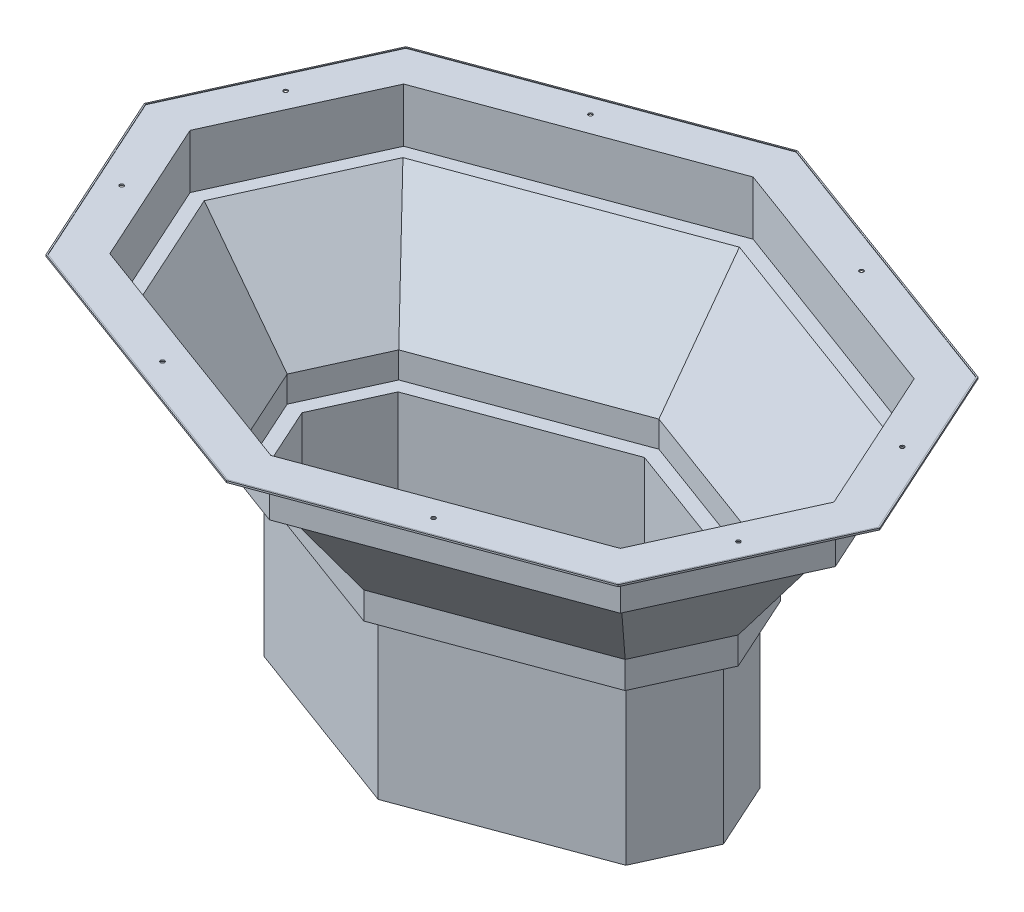
from build123d import *

# Parameters (mm, degrees)
BOSS_EXTRUDE1_DEPTH = 101.6
BOSS_EXTRUDE2_DEPTH = 50.8
BOSS_EXTRUDE3_DEPTH = 3.175
BOSS_EXTRUDE4_DEPTH = 304.8
SHELL2_T            = -2.38125
CUT_EXTRUDE1_REACH  = 1102.395
SKETCH8_R           = 3.81


with BuildPart() as part:
    # Sketch1 → Boss-Extrude1 (new body)
    with BuildSketch(Plane(origin=(0, 0, 0), x_dir=(1, 0, 0), z_dir=(0, 1, 0))):
        Polygon((-609.6, 0), (-483.050585246, 278.889385424), (0, 457.2), (483.050585246, 278.889385424), (609.6, 0), (483.050585246, -278.889385424), (0, -457.2), (-483.050585246, -278.889385424), align=None)
    extrude(amount=-BOSS_EXTRUDE1_DEPTH)

    # Sketch3 → Loft1 section 0
    with BuildSketch(Plane.XZ.offset(101.6)):
        with BuildLine():
            Line((-464.303577892, -258.734292578), (0, -430.124740809))
            Line((0, -430.124740809), (464.303577892, -258.734292578))
            Line((464.303577892, -258.734292578), (581.707376723, 0))
            Line((581.707376723, 0), (464.303577892, 258.734292578))
            Line((464.303577892, 258.734292578), (0, 430.124740809))
            Line((0, 430.124740809), (-464.303577892, 258.734292578))
            Line((-464.303577892, 258.734292578), (-581.707376723, 0))
            Line((-581.707376723, 0), (-464.303577892, -258.734292578))
        make_face()
    # Sketch2 → Loft1 section 1
    with BuildSketch(Plane(origin=(0, -304.8, 0), x_dir=(-1, 0, 0), z_dir=(0, -1, 0))):
        with BuildLine():
            Line((0, 279.492456), (-360.005239282, 146.602118161))
            Line((-360.005239282, 146.602118161), (-426.527714588, 0))
            Line((-426.527714588, 0), (-360.005239282, -146.602118161))
            Line((-360.005239282, -146.602118161), (0, -279.492456))
            Line((0, -279.492456), (360.005239282, -146.602118161))
            Line((360.005239282, -146.602118161), (426.527714588, 0))
            Line((426.527714588, 0), (360.005239282, 146.602118161))
            Line((360.005239282, 146.602118161), (0, 279.492456))
        make_face()
    loft()

    # Sketch4 → Boss-Extrude2 (add)
    with BuildSketch(Plane.XZ.offset(304.8)):
        Polygon((0, -279.492456), (360.005239282, -146.602118161), (426.527714588, 0), (360.005239282, 146.602118161), (0, 279.492456), (-360.005239282, 146.602118161), (-426.527714588, 0), (-360.005239282, -146.602118161), align=None)
    extrude(amount=BOSS_EXTRUDE2_DEPTH)

    # Sketch5 → Boss-Extrude3 (add)
    with BuildSketch(Plane(origin=(0, 0, 0), x_dir=(1, 0, 0), z_dir=(0, 1, 0))):
        Polygon((0, 538.425777574), (-539.291607309, 339.354663964), (-693.277869831, 0), (-539.291607309, -339.354663964), (0, -538.425777574), (539.291607309, -339.354663964), (693.277869831, 0), (539.291607309, 339.354663964), align=None)
    extrude(amount=BOSS_EXTRUDE3_DEPTH)

    # Sketch6 → Boss-Extrude4 (add)
    with BuildSketch(Plane.XZ.offset(355.6)):
        Polygon((0, 252.417196809), (-341.258231928, 126.447025314), (-398.635091311, 0), (-341.258231928, -126.447025314), (0, -252.417196809), (341.258231928, -126.447025314), (398.635091311, 0), (341.258231928, 126.447025314), align=None)
    extrude(amount=BOSS_EXTRUDE4_DEPTH)

    # Shell2
    shell2_openings = [part.faces().sort_by_distance(p)[0] for p in [
        (0, 3.175, 0),
    ]]
    offset(amount=SHELL2_T, openings=shell2_openings, kind=Kind.INTERSECTION)

    # Sketch8 → Cut-Extrude1 (cut, up to next)
    with BuildSketch(Plane(origin=(0, 3.175, 0), x_dir=(1, 0, 0), z_dir=(0, 1, 0)), mode=Mode.PRIVATE) as cut_extrude1_sk1:
        with Locations((-255.585548139, 403.467456741)):
            Circle(SKETCH8_R)
    cut_extrude1_tool1 = extrude(cut_extrude1_sk1.sketch, amount=-CUT_EXTRUDE1_REACH, mode=Mode.PRIVATE) & part.part
    # Sketch8 → Cut-Extrude1 (cut, up to next)
    with BuildSketch(Plane(origin=(0, 3.175, 0), x_dir=(1, 0, 0), z_dir=(0, 1, 0)), mode=Mode.PRIVATE) as cut_extrude1_sk2:
        with Locations((255.585548139, 403.467456741)):
            Circle(SKETCH8_R)
    cut_extrude1_tool2 = extrude(cut_extrude1_sk2.sketch, amount=-CUT_EXTRUDE1_REACH, mode=Mode.PRIVATE) & part.part
    # Sketch8 → Cut-Extrude1 (cut, up to next)
    with BuildSketch(Plane(origin=(0, 3.175, 0), x_dir=(1, 0, 0), z_dir=(0, 1, 0)), mode=Mode.PRIVATE) as cut_extrude1_sk3:
        with Locations((581.305015597, 154.561012347)):
            Circle(SKETCH8_R)
    cut_extrude1_tool3 = extrude(cut_extrude1_sk3.sketch, amount=-CUT_EXTRUDE1_REACH, mode=Mode.PRIVATE) & part.part
    # Sketch8 → Cut-Extrude1 (cut, up to next)
    with BuildSketch(Plane(origin=(0, 3.175, 0), x_dir=(1, 0, 0), z_dir=(0, 1, 0)), mode=Mode.PRIVATE) as cut_extrude1_sk4:
        with Locations((581.305015597, -154.561012347)):
            Circle(SKETCH8_R)
    cut_extrude1_tool4 = extrude(cut_extrude1_sk4.sketch, amount=-CUT_EXTRUDE1_REACH, mode=Mode.PRIVATE) & part.part
    # Sketch8 → Cut-Extrude1 (cut, up to next)
    with BuildSketch(Plane(origin=(0, 3.175, 0), x_dir=(1, 0, 0), z_dir=(0, 1, 0)), mode=Mode.PRIVATE) as cut_extrude1_sk5:
        with Locations((255.585548139, -403.467456741)):
            Circle(SKETCH8_R)
    cut_extrude1_tool5 = extrude(cut_extrude1_sk5.sketch, amount=-CUT_EXTRUDE1_REACH, mode=Mode.PRIVATE) & part.part
    # Sketch8 → Cut-Extrude1 (cut, up to next)
    with BuildSketch(Plane(origin=(0, 3.175, 0), x_dir=(1, 0, 0), z_dir=(0, 1, 0)), mode=Mode.PRIVATE) as cut_extrude1_sk6:
        with Locations((-255.585548139, -403.467456741)):
            Circle(SKETCH8_R)
    cut_extrude1_tool6 = extrude(cut_extrude1_sk6.sketch, amount=-CUT_EXTRUDE1_REACH, mode=Mode.PRIVATE) & part.part
    # Sketch8 → Cut-Extrude1 (cut, up to next)
    with BuildSketch(Plane(origin=(0, 3.175, 0), x_dir=(1, 0, 0), z_dir=(0, 1, 0)), mode=Mode.PRIVATE) as cut_extrude1_sk7:
        with Locations((-581.305015597, -154.561012347)):
            Circle(SKETCH8_R)
    cut_extrude1_tool7 = extrude(cut_extrude1_sk7.sketch, amount=-CUT_EXTRUDE1_REACH, mode=Mode.PRIVATE) & part.part
    # Sketch8 → Cut-Extrude1 (cut, up to next)
    with BuildSketch(Plane(origin=(0, 3.175, 0), x_dir=(1, 0, 0), z_dir=(0, 1, 0)), mode=Mode.PRIVATE) as cut_extrude1_sk8:
        with Locations((-581.305015597, 154.561012347)):
            Circle(SKETCH8_R)
    cut_extrude1_tool8 = extrude(cut_extrude1_sk8.sketch, amount=-CUT_EXTRUDE1_REACH, mode=Mode.PRIVATE) & part.part
    add(cut_extrude1_tool1.solids().sort_by_distance((-255.585548, 3.175, -403.467457))[0], mode=Mode.SUBTRACT)
    add(cut_extrude1_tool2.solids().sort_by_distance((255.585548, 3.175, -403.467457))[0], mode=Mode.SUBTRACT)
    add(cut_extrude1_tool3.solids().sort_by_distance((581.305016, 3.175, -154.561012))[0], mode=Mode.SUBTRACT)
    add(cut_extrude1_tool4.solids().sort_by_distance((581.305016, 3.175, 154.561012))[0], mode=Mode.SUBTRACT)
    add(cut_extrude1_tool5.solids().sort_by_distance((255.585548, 3.175, 403.467457))[0], mode=Mode.SUBTRACT)
    add(cut_extrude1_tool6.solids().sort_by_distance((-255.585548, 3.175, 403.467457))[0], mode=Mode.SUBTRACT)
    add(cut_extrude1_tool7.solids().sort_by_distance((-581.305016, 3.175, 154.561012))[0], mode=Mode.SUBTRACT)
    add(cut_extrude1_tool8.solids().sort_by_distance((-581.305016, 3.175, -154.561012))[0], mode=Mode.SUBTRACT)


solid = part.part
